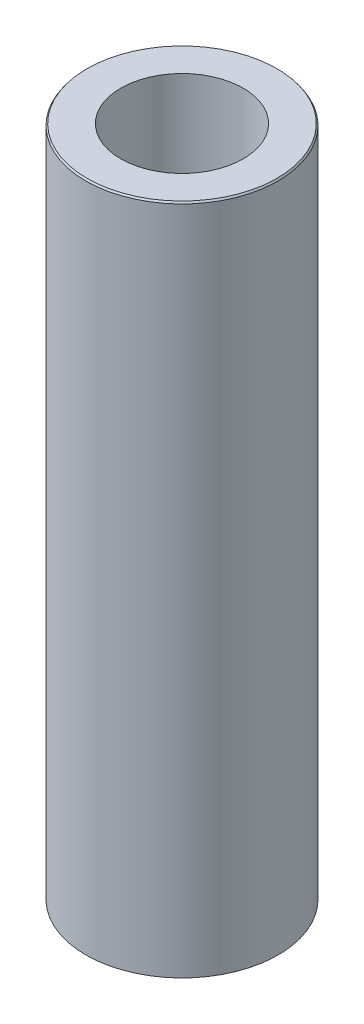
from build123d import *
from OCP.BRepFilletAPI import BRepFilletAPI_MakeChamfer

# Parameters (mm, degrees)
SKETCH1_R           = 50
BOSS_EXTRUDE1_DEPTH = 349.903128118
SKETCH2_R           = 31.843845761
CUT_EXTRUDE1_DEPTH  = 357.976468506
CHAMFER1_SIZE       = 0.877698901
CHAMFER1_SIZE2      = 0.62407261


with BuildPart() as part:
    # Sketch1 → Boss-Extrude1 (new body)
    with BuildSketch(Plane(origin=(0, 0, 0), x_dir=(1, 0, 0), z_dir=(0, 1, 0))):
        Circle(SKETCH1_R)
    extrude(amount=BOSS_EXTRUDE1_DEPTH)

    # Sketch2 → Cut-Extrude1 (cut, through all)
    with BuildSketch(Plane(origin=(0, 0, 0), x_dir=(1, 0, 0), z_dir=(0, 1, 0))):
        Circle(SKETCH2_R)
    extrude(amount=CUT_EXTRUDE1_DEPTH, mode=Mode.SUBTRACT)

    # Chamfer1: one chamfer whose edges measure the first distance from different faces: ONE call of the kernel's chamfer builder (chamfer() names one face for all edges)
    chamfer1_edges_1 = [part.edges().sort_by_distance(p)[0] for p in [
        (-50, 349.903128118, 0),
    ]]
    chamfer1_side_1 = [part.faces().sort_by_distance(p)[0] for p in [
        (-50, 174.951564059, 0),
    ]]
    chamfer1_edges_2 = [part.edges().sort_by_distance(p)[0] for p in [
        (-50, 0, 0),
    ]]
    chamfer1_side_2 = [part.faces().sort_by_distance(p)[0] for p in [
        (-48.585786438, 0, 0),
    ]]
    chamfer1 = BRepFilletAPI_MakeChamfer(part.part.solid().wrapped)
    for e in chamfer1_edges_1:
        chamfer1.Add(CHAMFER1_SIZE, CHAMFER1_SIZE2, e.wrapped, chamfer1_side_1[0].wrapped)  # the first distance lies on this face
    for e in chamfer1_edges_2:
        chamfer1.Add(CHAMFER1_SIZE, CHAMFER1_SIZE2, e.wrapped, chamfer1_side_2[0].wrapped)  # the first distance lies on this face
    add(Compound.cast(chamfer1.Shape()), mode=Mode.REPLACE)


solid = part.part
